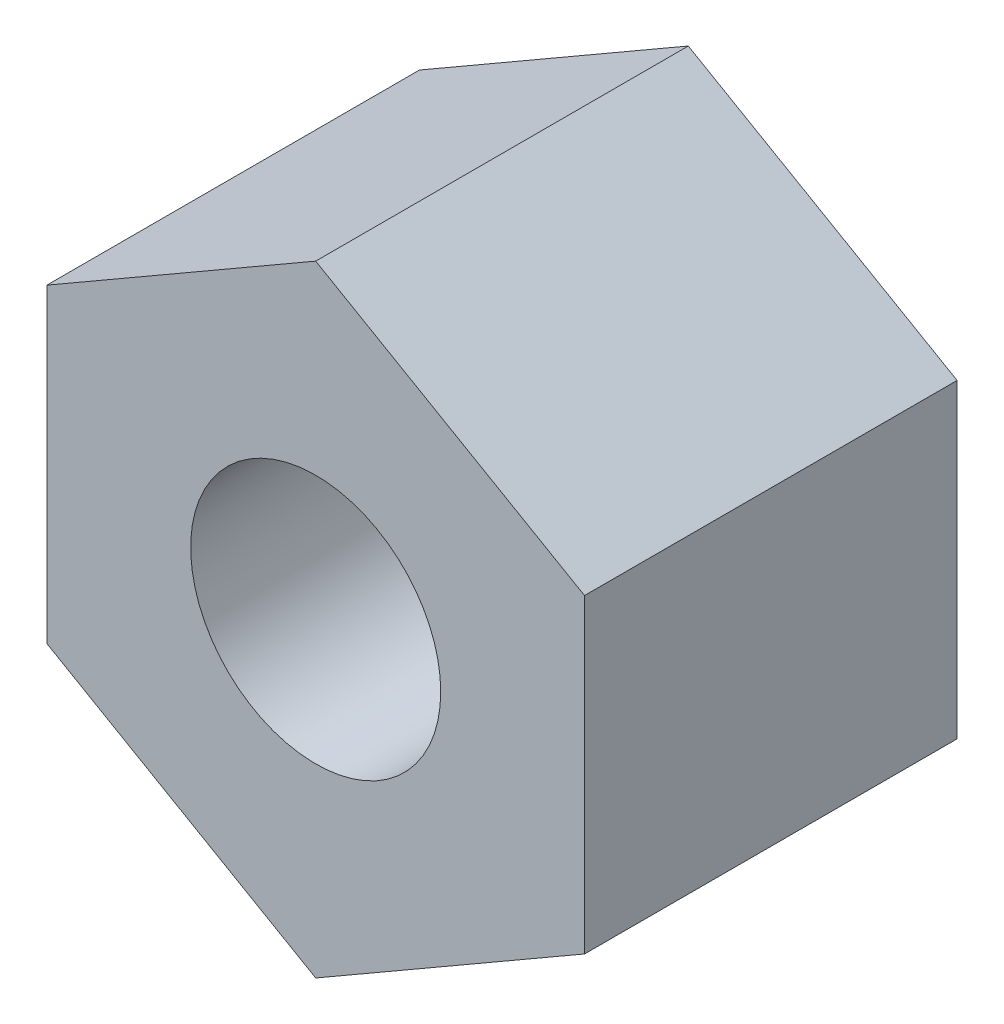
from build123d import *

# Parameters (mm, degrees)
BOSS_EXTRUDE1_DEPTH = 5.96
CUT_EXTRUDE1_REACH  = 10.869
SKETCH2_R           = 2


with BuildPart() as part:
    # Sketch1 → Boss-Extrude1 (new body)
    with BuildSketch(Plane(origin=(0, 0, 0), x_dir=(0, 1, 0), z_dir=(0, 0, 1))):
        Polygon((4.965212315, 0), (2.482606158, 4.3), (-2.482606158, 4.3), (-4.965212315, 0), (-2.482606158, -4.3), (2.482606158, -4.3), align=None)
    extrude(amount=BOSS_EXTRUDE1_DEPTH)

    # Sketch2 → Cut-Extrude1 (cut, up to next)
    with BuildSketch(Plane(origin=(0, 0, 0), x_dir=(0, 1, 0), z_dir=(0, 0, 1)), mode=Mode.PRIVATE) as cut_extrude1_sk1:
        Circle(SKETCH2_R)
    cut_extrude1_tool1 = extrude(cut_extrude1_sk1.sketch, amount=CUT_EXTRUDE1_REACH, mode=Mode.PRIVATE) & part.part
    add(cut_extrude1_tool1.solids().sort_by_distance((0, 0, 0))[0], mode=Mode.SUBTRACT)


solid = part.part
